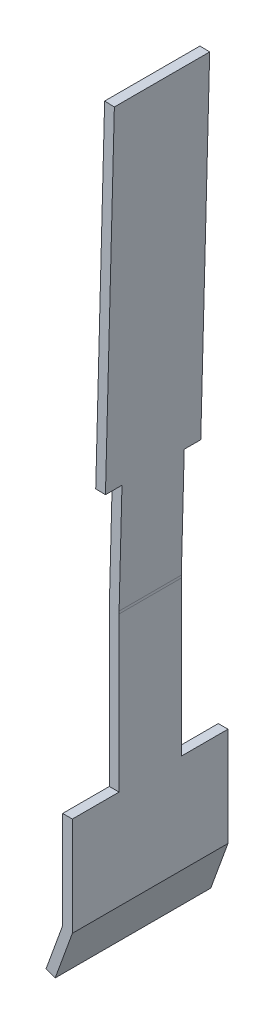
from build123d import *

# Parameters (mm, degrees)
EXTRUDE_2_DEPTH      = 16
SKETCH_31_W          = 4.8
SKETCH_31_H          = 46.486909283
CUT_EXTRUDE_6_DEPTH  = 67.474283586
SKETCH_32_W          = 4.8
SKETCH_32_H          = 14.308405558
CUT_EXTRUDE_7_DEPTH  = 16
FILLET_1_R           = 10
FILLET_2_R           = 10
SKETCH_39_W          = 1.7
SKETCH_39_H          = 35
EXTRUDE_1_DEPTH      = 1
SKETCH_40_W          = 1
SKETCH_40_H          = 4.8
CUT_EXTRUDE_8_DEPTH  = 10
SKETCH_41_W          = 3.264842031
SKETCH_41_H          = 6.457557915
CUT_EXTRUDE_9_DEPTH  = 10
SKETCH_42_W          = 4.8
SKETCH_42_H          = 1.68
CUT_EXTRUDE_10_DEPTH = 10
EXTRUDE_3_DEPTH      = 16


with BuildPart() as part:
    # 草图28 → 拉伸-薄壁2 (new body)
    with BuildSketch(Plane.XY):
        Polygon((0, 0), (0, 18), (1.217228096, 64.484065611), (2.216885421, 64.457888663), (1, 17.986909283), (1, 0), align=None)
    extrude(amount=EXTRUDE_2_DEPTH)

    # 草图31 → 切除-拉伸6 (cut, through all)
    with BuildSketch(Plane(origin=(0.528633719, -0.013842761, 0), x_dir=(0, 0, -1), z_dir=(0.9996573249755574, -0.02617694830787331, 0))):
        with Locations((-13.6, 41.250377209)):
            Rectangle(SKETCH_31_W, SKETCH_31_H)
        with Locations((-2.4, 41.250377209)):
            Rectangle(SKETCH_31_W, SKETCH_31_H)
    extrude(amount=-CUT_EXTRUDE_6_DEPTH, mode=Mode.SUBTRACT)

    # 草图32 → 切除-拉伸7 (cut)
    with BuildSketch(Plane(origin=(1, 0, 0), x_dir=(0, 0, -1), z_dir=(1, 0, 0))):
        with Locations((-13.6, 10.832706504)):
            Rectangle(SKETCH_32_W, SKETCH_32_H)
        with Locations((-2.4, 10.832706504)):
            Rectangle(SKETCH_32_W, SKETCH_32_H)
    extrude(amount=-CUT_EXTRUDE_7_DEPTH, mode=Mode.SUBTRACT)

    # 圆角1
    # the kernel refuses this fillet: 10 mm, written as the material it takes off along each edge
    with BuildSketch(Plane(origin=(0, 18, -0.327267927), x_dir=(0, -1, 0), z_dir=(0, 0, 1))) as fillet_1_piece_1:
        with BuildLine():
            CenterArc((FILLET_1_R * 0.0130907170848, FILLET_1_R), FILLET_1_R, 268.5, 1.5)
            Line((-FILLET_1_R * 0.013086231223, FILLET_1_R * 0.000342675024443), (0, 0))
            Line((0, 0), (FILLET_1_R * 0.0130907170848, 0))
        make_face()
    extrude(amount=16.654535854, mode=Mode.SUBTRACT)

    # 圆角2
    # the kernel refuses this fillet: 10 mm, written as the material it adds along each edge
    with BuildSketch(Plane(origin=(1, 17.986909283, 4.8), x_dir=(0, -1, 0), z_dir=(0, 0, 1))) as fillet_2_piece_1:
        with BuildLine():
            CenterArc((FILLET_2_R * 0.0130907170848, FILLET_2_R), FILLET_2_R, 268.5, 1.5)
            Line((-FILLET_2_R * 0.013086231223, FILLET_2_R * 0.000342675024443), (0, 0))
            Line((0, 0), (FILLET_2_R * 0.0130907170848, 0))
        make_face()
    extrude(amount=6.4)

    # 草图39 → 凸台-拉伸1 (add)
    with BuildSketch(Plane(origin=(-0.471023606, 0.012334187, 0), x_dir=(0, 0, 1), z_dir=(-0.9996573249755574, 0.026176948307873305, 0))):
        with Locations((12.05, 46.99383185)):
            Rectangle(SKETCH_39_W, SKETCH_39_H)
        with Locations((3.95, 46.99383185)):
            Rectangle(SKETCH_39_W, SKETCH_39_H)
    extrude(amount=-EXTRUDE_1_DEPTH)

    # 草图40 → 切除-拉伸8 (cut)
    with BuildSketch(Plane(origin=(0.471366281, 18.000752044, 0), x_dir=(0.9996573249755574, -0.02617694830787331, 0), z_dir=(0.02617694830787331, 0.9996573249755574, 0))):
        with Locations((0.02881493, -13.6)):
            Rectangle(SKETCH_40_W, SKETCH_40_H)
    extrude(amount=-CUT_EXTRUDE_8_DEPTH, mode=Mode.SUBTRACT)

    # 草图41 → 切除-拉伸9 (cut)
    with BuildSketch(Plane(origin=(0.471366281, 18.000752044, 0), x_dir=(0.9996573249755574, -0.02617694830787331, 0), z_dir=(0.02617694830787331, 0.9996573249755574, 0))):
        with Locations((-1.103606086, -1.571221043)):
            Rectangle(SKETCH_41_W, SKETCH_41_H)
    extrude(amount=-CUT_EXTRUDE_9_DEPTH, mode=Mode.SUBTRACT)

    # 草图42 → 切除-拉伸10 (cut)
    with BuildSketch(Plane(origin=(1, 0, 0), x_dir=(0, 0, -1), z_dir=(1, 0, 0))):
        with Locations((-2.4, 2.838503725)):
            Rectangle(SKETCH_42_W, SKETCH_42_H)
        with Locations((-13.6, 2.838503725)):
            Rectangle(SKETCH_42_W, SKETCH_42_H)
    extrude(amount=-CUT_EXTRUDE_10_DEPTH, mode=Mode.SUBTRACT)

    # 草图44 → 拉伸-薄壁3 (add)
    with BuildSketch(Plane(origin=(0, 0, 0), x_dir=(-1, 0, 0), z_dir=(0, 0, -1))):
        Polygon((0, 0), (0, -8), (1.710100717, -12.698463104), (0.770408096, -13.040483247), (-1, -8.176326981), (-1, 0), align=None)
    extrude(amount=-EXTRUDE_3_DEPTH)


solid = part.part
